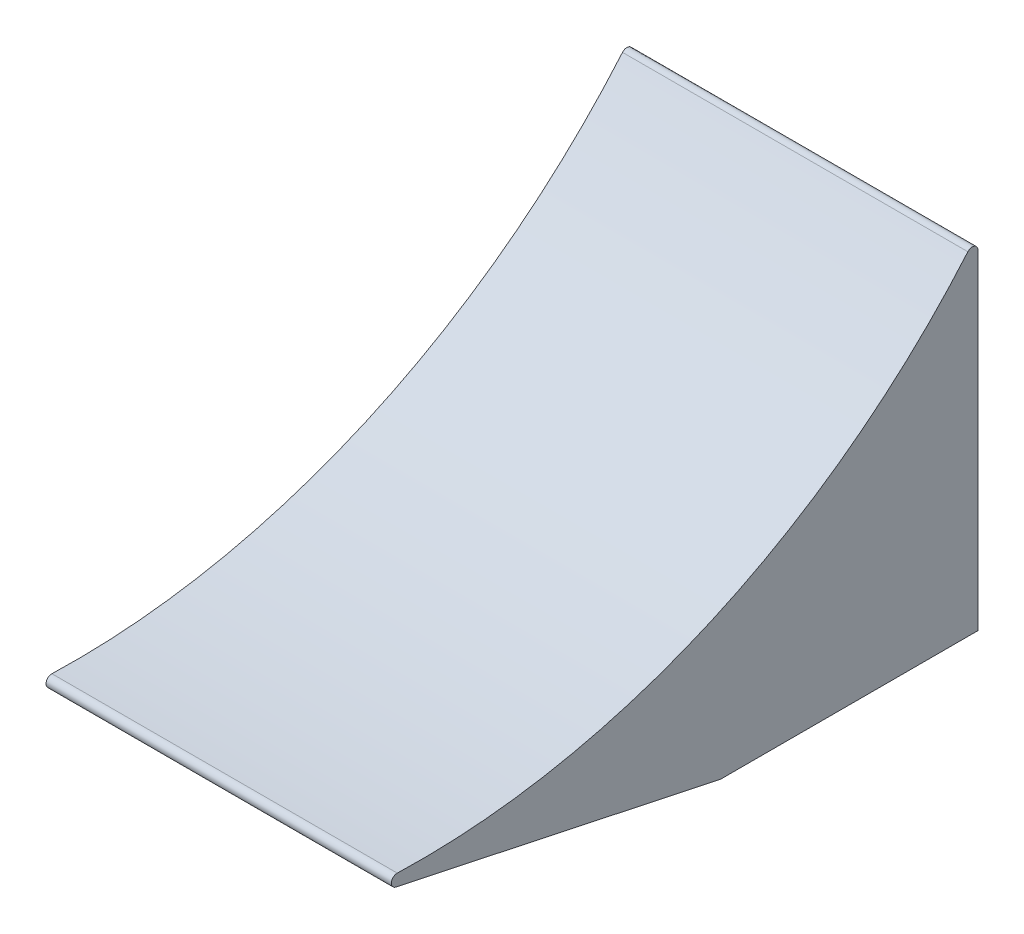
from build123d import *

# Parameters (mm, degrees)
BOSS_EXTRUDE1_DEPTH = 38.1
FILLET1_R           = 1.27


with BuildPart() as part:
    # Sketch1 → Boss-Extrude1 (new, symmetric)
    with BuildSketch(Plane(origin=(0, 0, 0), x_dir=(0, 0, -1), z_dir=(1, 0, 0))):
        with BuildLine():
            Line((28.422826333, 0), (-28.422826333, 0))
            Line((-28.422826333, 0), (-127.802622568, 21.123827787))
            ThreePointArc((-127.802622568, 21.123827787), (-41.944172269, 26.690897226), (28.422826333, 76.2))
            Line((28.422826333, 76.2), (28.422826333, 0))
        make_face()
    extrude(amount=BOSS_EXTRUDE1_DEPTH, both=True)

    # Fillet1
    fillet1_edges = [part.edges().sort_by_distance(p)[0] for p in [
        (0, 76.2, -28.422826333),
    ]]
    fillet(fillet1_edges, radius=FILLET1_R)
    fillet1_2_edges = [part.edges().sort_by_distance(p)[0] for p in [
        (0, 21.123827787, 127.802622568),
    ]]
    fillet(fillet1_2_edges, radius=FILLET1_R)


solid = part.part
